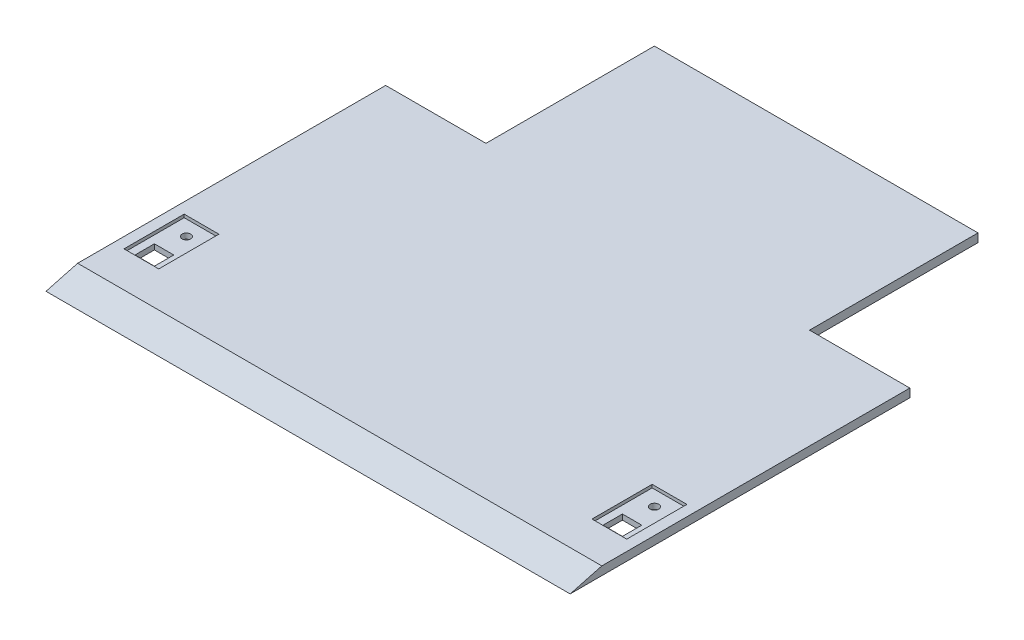
from build123d import *

# Parameters (mm, degrees)
SALIENTE_EXTRUIR1_DEPTH = 196
CORTAR_EXTRUIR1_REACH   = 274.995
CROQUIS2_W              = 37.5
CROQUIS2_H              = 62.989872981
CROQUIS3_W              = 13
CROQUIS3_H              = 22.5
CORTAR_EXTRUIR2_DEPTH   = 1.17
CORTAR_EXTRUIR3_REACH   = 274.984
CROQUIS5_W              = 7.25
CROQUIS5_H              = 7.25
CORTAR_EXTRUIR4_REACH   = 274.984
CROQUIS6_R              = 1.6


with BuildPart() as part:
    # Croquis1 → Saliente-Extruir1 (new body)
    with BuildSketch(Plane(origin=(0, 0, 0), x_dir=(0, 0, -1), z_dir=(1, 0, 0))):
        Polygon((0, 0), (190, 0), (190, 3.17), (11.83060106, 3.17), align=None)
    extrude(amount=SALIENTE_EXTRUIR1_DEPTH)

    # Croquis2 → Cortar-Extruir1 (cut, up to next)
    with BuildSketch(Plane(origin=(0, 0, 0), x_dir=(-1, 0, 0), z_dir=(0, -1, 0)), mode=Mode.PRIVATE) as cortar_extruir1_sk1:
        with Locations((-18.75, 158.50506351)):
            Rectangle(CROQUIS2_W, CROQUIS2_H)
    cortar_extruir1_tool1 = extrude(cortar_extruir1_sk1.sketch, amount=-CORTAR_EXTRUIR1_REACH, mode=Mode.PRIVATE) & part.part
    cortar_extruir1 = cortar_extruir1_tool1.solids().sort_by_distance((18.75, 0, -158.505064))[0]
    add(cortar_extruir1, mode=Mode.SUBTRACT)

    # Simetría1: Cortar-Extruir1 across plane
    add(cortar_extruir1.mirror(Plane.ZY.offset(-98)), mode=Mode.SUBTRACT)

    # Croquis3 → Cortar-Extruir2 (cut)
    with BuildSketch(Plane(origin=(0, 3.17, 0), x_dir=(1, 0, 0), z_dir=(0, 1, 0))):
        with Locations((10.5, 36.41)):
            Rectangle(CROQUIS3_W, CROQUIS3_H)
    cortar_extruir2 = extrude(amount=-CORTAR_EXTRUIR2_DEPTH, mode=Mode.SUBTRACT)

    # Croquis5 → Cortar-Extruir3 (cut, up to next)
    with BuildSketch(Plane(origin=(0, 2, 0), x_dir=(1, 0, 0), z_dir=(0, 1, 0)), mode=Mode.PRIVATE) as cortar_extruir3_sk1:
        with Locations((10.5, 30.035)):
            Rectangle(CROQUIS5_W, CROQUIS5_H)
    cortar_extruir3_tool1 = extrude(cortar_extruir3_sk1.sketch, amount=-CORTAR_EXTRUIR3_REACH, mode=Mode.PRIVATE) & part.part
    cortar_extruir3 = cortar_extruir3_tool1.solids().sort_by_distance((10.5, 2, -30.035))[0]
    add(cortar_extruir3, mode=Mode.SUBTRACT)

    # Croquis6 → Cortar-Extruir4 (cut, up to next)
    with BuildSketch(Plane(origin=(0, 2, 0), x_dir=(1, 0, 0), z_dir=(0, 1, 0)), mode=Mode.PRIVATE) as cortar_extruir4_sk1:
        with Locations((10.5, 42.01)):
            Circle(CROQUIS6_R)
    cortar_extruir4_tool1 = extrude(cortar_extruir4_sk1.sketch, amount=-CORTAR_EXTRUIR4_REACH, mode=Mode.PRIVATE) & part.part
    cortar_extruir4 = cortar_extruir4_tool1.solids().sort_by_distance((10.5, 2, -42.01))[0]
    add(cortar_extruir4, mode=Mode.SUBTRACT)

    # Simetría2: Cortar-Extruir2, Cortar-Extruir3, Cortar-Extruir4 across plane
    add(cortar_extruir2.mirror(Plane.ZY.offset(-98)), mode=Mode.SUBTRACT)
    add(cortar_extruir3.mirror(Plane.ZY.offset(-98)), mode=Mode.SUBTRACT)
    add(cortar_extruir4.mirror(Plane.ZY.offset(-98)), mode=Mode.SUBTRACT)


solid = part.part
